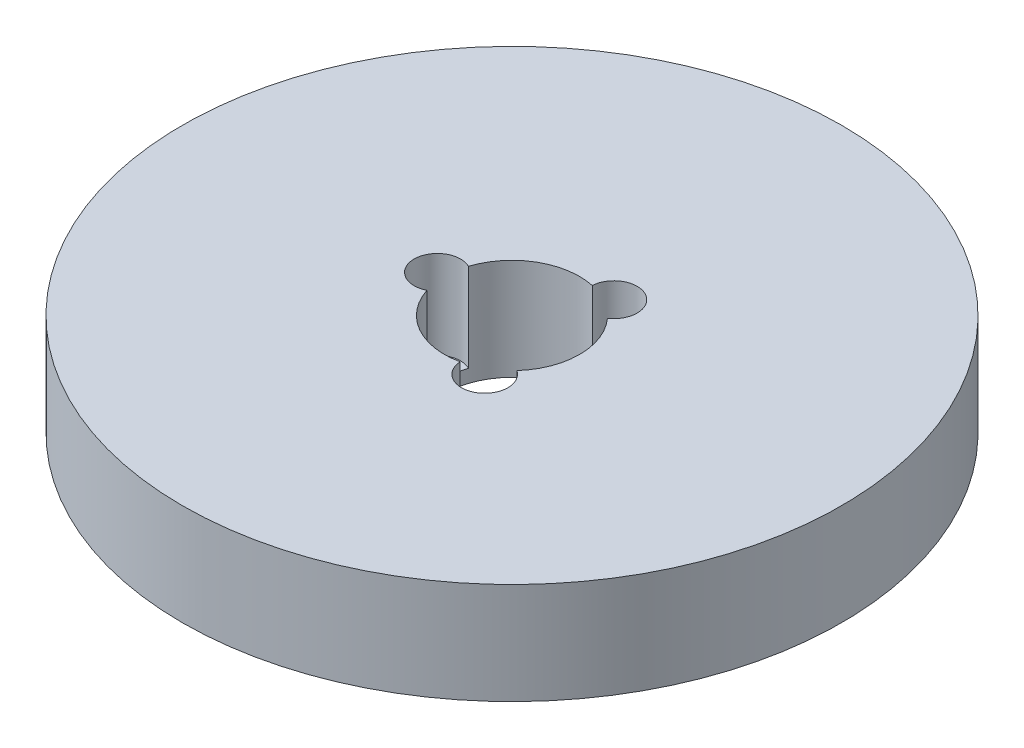
from build123d import *

# Parameters (mm, degrees)
SKETCH1_R           = 97.5
BOSS_EXTRUDE1_DEPTH = 30
SKETCH2_R           = 20
CUT_EXTRUDE1_DEPTH  = 142.111657917
SKETCH3_R           = 6.867943311
CUT_EXTRUDE2_DEPTH  = 26.109463305
CIRPATTERN1_COUNT   = 3


with BuildPart() as part:
    # Sketch1 → Boss-Extrude1 (new body)
    with BuildSketch(Plane(origin=(0, 0, 0), x_dir=(1, 0, 0), z_dir=(0, 1, 0))):
        Circle(SKETCH1_R)
    extrude(amount=BOSS_EXTRUDE1_DEPTH)

    # Sketch2 → Cut-Extrude1 (cut, through all)
    with BuildSketch(Plane(origin=(0, 0, 0), x_dir=(1, 0, 0), z_dir=(0, 1, 0))):
        Circle(SKETCH2_R)
    extrude(amount=CUT_EXTRUDE1_DEPTH, mode=Mode.SUBTRACT)

    # Sketch3 → Cut-Extrude2 (cut)
    with BuildSketch(Plane(origin=(0, 30, 0), x_dir=(1, 0, 0), z_dir=(0, 1, 0))):
        with Locations((-22.081174807, 0)):
            Circle(SKETCH3_R)
    cut_extrude2 = extrude(amount=-CUT_EXTRUDE2_DEPTH, mode=Mode.SUBTRACT)

    # CirPattern1: Cut-Extrude2 ×3 about axis
    cirpattern1_axis = Axis((0, 0, 0), (0, 1, 0))
    for i in range(1, CIRPATTERN1_COUNT):
        add(cut_extrude2.rotate(cirpattern1_axis, i * 360 / CIRPATTERN1_COUNT), mode=Mode.SUBTRACT)


solid = part.part
